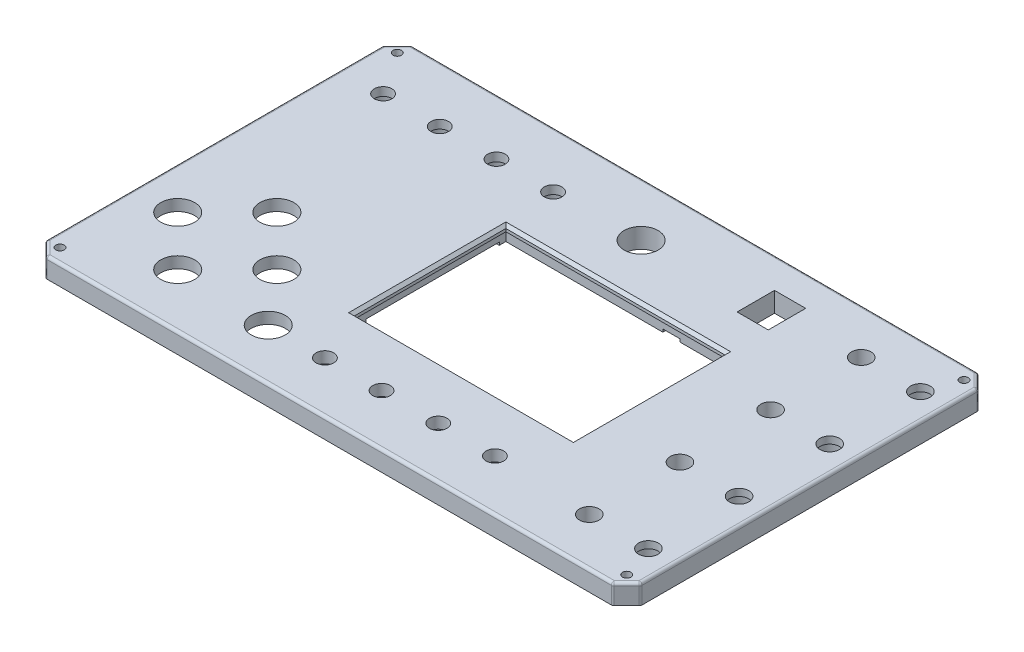
from build123d import *

# Parameters (mm, degrees)
SKETCH1_W           = 105
SKETCH1_H           = 69
BOSS_EXTRUDE1_DEPTH = 5
SKETCH2_W           = 86.836
SKETCH2_H           = 57.499
CUT_EXTRUDE1_DEPTH  = 81.210380614
CUT_EXTRUDE2_DEPTH  = 1
SKETCH4_W           = 5
SKETCH4_H           = 2.165
SKETCH4_H_2         = 0.335
CUT_EXTRUDE3_DEPTH  = 1
CUT_EXTRUDE4_DEPTH  = 81.210380614
SKETCH9_R           = 1
CUT_EXTRUDE7_DEPTH  = 4
SKETCH7_W           = 105
SKETCH7_H           = 30
BOSS_EXTRUDE2_DEPTH = 5
SKETCH8_W           = 11
SKETCH8_H           = 13.2
CUT_EXTRUDE6_DEPTH  = 84.315664794
SKETCH10_W          = 105
SKETCH10_H          = 129
SKETCH10_W_2        = 86.836
SKETCH10_H_2        = 57.499
SKETCH10_W_3        = 11
SKETCH10_H_3        = 13.2
BOSS_EXTRUDE3_DEPTH = 2
SKETCH11_W          = 77.336
SKETCH11_H          = 53.499
BOSS_EXTRUDE4_DEPTH = 2
CHAMFER1_SIZE       = 1
SKETCH12_W          = 65
SKETCH12_H          = 129
SKETCH12_R          = 6
BOSS_EXTRUDE5_DEPTH = 7
CUT_EXTRUDE8_DEPTH  = 135.221831309
CUT_EXTRUDE9_START  = -3
SKETCH16_R          = 5.5
SKETCH16_R_2        = 3.1
CUT_EXTRUDE9_DEPTH  = 3
SKETCH18_R          = 10
CUT_EXTRUDE10_DEPTH = 3
CHAMFER2_SIZE       = 1
SKETCH19_W          = 17.7
SKETCH19_H          = 13.5
CUT_EXTRUDE11_DEPTH = 2
SKETCH20_W          = 17.7
SKETCH20_H          = 3.413443427
SKETCH20_H_2        = 4.222497079
CUT_EXTRUDE12_DEPTH = 1
SKETCH22_W          = 35.5
SKETCH22_H          = 10
SKETCH22_R          = 1
CUT_EXTRUDE13_DEPTH = 2
SKETCH23_R          = 1
CUT_EXTRUDE14_DEPTH = 4
CUT_EXTRUDE15_DEPTH = 1
SKETCH25_R          = 3.1
CUT_EXTRUDE16_DEPTH = 135.221831309
SKETCH26_R          = 5.15
CUT_EXTRUDE17_DEPTH = 4
SKETCH27_W          = 40
SKETCH27_H          = 129
BOSS_EXTRUDE6_DEPTH = 7
LPATTERN1_COUNT     = 2
LPATTERN1_PITCH     = 40
SKETCH28_R          = 3.45
CUT_EXTRUDE18_DEPTH = 135.221831309
SKETCH29_R          = 3.45
CUT_EXTRUDE19_DEPTH = 135.221831309
SKETCH30_R          = 5
CUT_EXTRUDE20_DEPTH = 4.5
SKETCH31_R          = 5.5
CUT_EXTRUDE21_DEPTH = 2
CUT_EXTRUDE22_DEPTH = 2.5
LPATTERN2_COUNT     = 4
LPATTERN2_PITCH     = 32
SKETCH33_R          = 6
CUT_EXTRUDE23_DEPTH = 135.221831309
SKETCH34_R          = 10
CUT_EXTRUDE24_DEPTH = 3
CHAMFER3_SIZE       = 1
CHAMFER4_SIZE       = 5
FILLET1_R           = 1
SKETCH36_R          = 1.5
CUT_EXTRUDE25_DEPTH = 135.221831309
SKETCH38_W          = 2.122677514
SKETCH38_H          = 1.133368936
SKETCH38_W_2        = 1.23177605
SKETCH38_H_2        = 4.109309896
SKETCH38_W_3        = 2.093358764
SKETCH38_H_3        = 1.448947712
SKETCH38_W_4        = 2.046448763
SKETCH38_H_4        = 0.961655006
SKETCH38_H_5        = 1.340362295
CUT_EXTRUDE27_DEPTH = 2
SKETCH40_R          = 6
CUT_EXTRUDE28_DEPTH = 135.221831309


with BuildPart() as part:
    # Sketch1 → Boss-Extrude1 (new body)
    with BuildSketch(Plane(origin=(0, 0, 0), x_dir=(1, 0, 0), z_dir=(0, 1, 0))):
        Rectangle(SKETCH1_W, SKETCH1_H)
    extrude(amount=BOSS_EXTRUDE1_DEPTH)

    # Sketch2 → Cut-Extrude1 (cut, through all)
    with BuildSketch(Plane(origin=(17.072113262, 0, 5.103361153), x_dir=(-1, 0, 0), z_dir=(0, -1, 0))):
        with Locations((16.310113262, 4.341361153)):
            Rectangle(SKETCH2_W, SKETCH2_H)
    extrude(amount=-CUT_EXTRUDE1_DEPTH, mode=Mode.SUBTRACT)

    # Sketch3 → Cut-Extrude2 (cut)
    with BuildSketch(Plane(origin=(17.072113262, 0, 5.103361153), x_dir=(-1, 0, 0), z_dir=(0, -1, 0))):
        Polygon((59.822113262, 30.765861153), (54.524773562, 30.765861153), (54.524773562, -16.234138847), (59.822113262, -16.234138847), (65.822113262, -16.234138847), (65.822113262, 30.765861153), align=None)
    extrude(amount=-CUT_EXTRUDE2_DEPTH, mode=Mode.SUBTRACT)

    # Sketch4 → Cut-Extrude3 (cut)
    with BuildSketch(Plane(origin=(17.072113262, 0, 5.103361153), x_dir=(-1, 0, 0), z_dir=(0, -1, 0))):
        Polygon((-1.187888405, 35.255861153), (3.812111595, 35.255861153), (3.812111595, 33.090861153), (4.312111595, 33.090861153), (4.312111595, 35.755861153), (-1.687888405, 35.755861153), (-1.687888405, 33.090861153), (-1.187888405, 33.090861153), align=None)
        with Locations((1.312111595, 34.173361153)):
            Rectangle(SKETCH4_W, SKETCH4_H)
        Polygon((4.312111595, 33.090861153), (3.812111595, 33.090861153), (3.812111595, 32.755861153), (-1.187888405, 32.755861153), (-1.187888405, 33.090861153), (-1.687888405, 33.090861153), (-1.687888405, 32.255861153), (4.312111595, 32.255861153), align=None)
        with Locations((1.312111595, 32.923361153)):
            Rectangle(SKETCH4_W, SKETCH4_H_2)
    extrude(amount=-CUT_EXTRUDE3_DEPTH, mode=Mode.SUBTRACT)

    # Sketch5 → Cut-Extrude4 (cut, through all)
    with BuildSketch(Plane(origin=(17.072113262, 0, 5.103361153), x_dir=(-1, 0, 0), z_dir=(0, -1, 0))):
        with BuildLine():
            Line((-31.677886738, -0.896638847), (-31.677886738, 11.103361153))
            ThreePointArc((-31.677886738, 11.103361153), (-31.220399504, 12.207833039), (-30.115927617, 12.665320274))
            Line((-30.115927617, 12.665320274), (-28.350143546, 12.665320274))
            ThreePointArc((-28.350143546, 12.665320274), (-27.521232808, 13.008666344), (-27.177886738, 13.837577082))
            Line((-27.177886738, 13.837577082), (-18.865935491, 13.837577082))
            Line((-18.865935491, 13.837577082), (-18.865935491, -4.56597095))
            Line((-18.865935491, -4.56597095), (-27.177886738, -4.56597095))
            ThreePointArc((-27.177886738, -4.56597095), (-27.60841615, -3.526581006), (-28.647806094, -3.096051594))
            Line((-28.647806094, -3.096051594), (-29.478473991, -3.096051594))
            ThreePointArc((-29.478473991, -3.096051594), (-31.033693659, -2.451858515), (-31.677886738, -0.896638847))
        make_face()
    extrude(amount=-CUT_EXTRUDE4_DEPTH, mode=Mode.SUBTRACT)

    # Sketch9 → Cut-Extrude7 (cut)
    with BuildSketch(Plane(origin=(17.072113262, 0, 5.103361153), x_dir=(-1, 0, 0), z_dir=(0, -1, 0))):
        with Locations(Location((-28.677886738, 33.103361153, 0), (0, 0, 90))):
            Circle(SKETCH9_R)
        with Locations(Location((62.822113262, 33.103361153, 0), (0, 0, 90))):
            Circle(SKETCH9_R)
        with Locations(Location((-28.677886738, -22.896638847, 0), (0, 0, 90))):
            Circle(SKETCH9_R)
        with Locations(Location((62.822113262, -22.896638847, 0), (0, 0, 90))):
            Circle(SKETCH9_R)
    extrude(amount=-CUT_EXTRUDE7_DEPTH, mode=Mode.SUBTRACT)

    # Sketch7 → Boss-Extrude2 (add)
    with BuildSketch(Plane(origin=(0, 5, 0), x_dir=(1, 0, 0), z_dir=(0, 1, 0))):
        with Locations((0, 49.5)):
            Rectangle(SKETCH7_W, SKETCH7_H)
        with Locations((0, -49.5)):
            Rectangle(SKETCH7_W, SKETCH7_H)
    extrude(amount=-BOSS_EXTRUDE2_DEPTH)

    # Sketch8 → Cut-Extrude6 (cut, through all)
    with BuildSketch(Plane(origin=(0, 5, 0), x_dir=(1, 0, 0), z_dir=(0, 1, 0))):
        with Locations((32.18, 46.886314888)):
            Rectangle(SKETCH8_W, SKETCH8_H)
    extrude(amount=-CUT_EXTRUDE6_DEPTH, mode=Mode.SUBTRACT)

    # Sketch10 → Boss-Extrude3 (add)
    with BuildSketch(Plane(origin=(0, 5, 0), x_dir=(1, 0, 0), z_dir=(0, 1, 0))):
        Rectangle(SKETCH10_W, SKETCH10_H)
        with Locations((0.762, -0.762)):
            Rectangle(SKETCH10_W_2, SKETCH10_H_2, mode=Mode.SUBTRACT)
        with Locations((32.18, 46.886314888)):
            Rectangle(SKETCH10_W_3, SKETCH10_H_3, mode=Mode.SUBTRACT)
    extrude(amount=BOSS_EXTRUDE3_DEPTH)

    # Sketch11 → Boss-Extrude4 (add)
    with BuildSketch(Plane(origin=(0, 7, 0), x_dir=(1, 0, 0), z_dir=(0, 1, 0))):
        Polygon((-40.656, 27.9875), (-42.656, 27.9875), (-42.656, 25.9875), (-42.656, -27.5115), (-42.656, -29.5115), (-40.656, -29.5115), (36.68, -29.5115), (44.18, -29.5115), (44.18, 27.9875), (36.68, 27.9875), align=None)
        with Locations((-1.988, -0.762)):
            Rectangle(SKETCH11_W, SKETCH11_H, mode=Mode.SUBTRACT)
    extrude(amount=-BOSS_EXTRUDE4_DEPTH)

    # Chamfer1
    chamfer1_edges = [part.edges().sort_by_distance(p)[0] for p in [
        (-40.656, 7, 0.762),
        (-1.988, 7, 27.5115),
        (36.68, 7, 0.762),
        (-1.988, 7, -25.9875),
    ]]
    chamfer(chamfer1_edges, length=CHAMFER1_SIZE)

    # Sketch12 → Boss-Extrude5 (add)
    with BuildSketch(Plane(origin=(0, 7, 0), x_dir=(1, 0, 0), z_dir=(0, 1, 0))):
        with Locations((-85, 0)):
            Rectangle(SKETCH12_W, SKETCH12_H)
        with Locations(Location((-85, -45.5, 0), (0, 0, 270))):
            Circle(SKETCH12_R, mode=Mode.SUBTRACT)
        with Locations(Location((-102.5, -28, 0), (0, 0, 270))):
            Circle(SKETCH12_R, mode=Mode.SUBTRACT)
        with Locations(Location((-67.5, -28, 0), (0, 0, 270))):
            Circle(SKETCH12_R, mode=Mode.SUBTRACT)
        with Locations(Location((-85, -10.5, 0), (0, 0, 270))):
            Circle(SKETCH12_R, mode=Mode.SUBTRACT)
    extrude(amount=-BOSS_EXTRUDE5_DEPTH)

    # Sketch15 → Cut-Extrude8 (cut, through all)
    with BuildSketch(Plane(origin=(0, 7, 0), x_dir=(1, 0, 0), z_dir=(0, 1, 0))):
        with BuildLine():
            ThreePointArc((-28.941, -46.50575), (-32.041, -43.40575), (-35.141, -46.50575))
            Line((-35.141, -46.50575), (-28.941, -46.50575))
        make_face()
        with BuildLine():
            Line((-28.941, -46.50575), (-35.141, -46.50575))
            ThreePointArc((-35.141, -46.50575), (-32.041, -49.60575), (-28.941, -46.50575))
        make_face()
        with BuildLine():
            ThreePointArc((-8.941, -46.50575), (-12.041, -43.40575), (-15.141, -46.50575))
            Line((-15.141, -46.50575), (-8.941, -46.50575))
        make_face()
        with BuildLine():
            Line((-8.941, -46.50575), (-15.141, -46.50575))
            ThreePointArc((-15.141, -46.50575), (-12.041, -49.60575), (-8.941, -46.50575))
        make_face()
        with BuildLine():
            ThreePointArc((4.859, -46.50575), (7.959, -49.60575), (11.059, -46.50575))
            Line((11.059, -46.50575), (4.859, -46.50575))
        make_face()
        with BuildLine():
            Line((4.859, -46.50575), (11.059, -46.50575))
            ThreePointArc((11.059, -46.50575), (7.959, -43.40575), (4.859, -46.50575))
        make_face()
        with BuildLine():
            ThreePointArc((24.859, -46.50575), (27.959, -49.60575), (31.059, -46.50575))
            Line((31.059, -46.50575), (24.859, -46.50575))
        make_face()
        with BuildLine():
            Line((24.859, -46.50575), (31.059, -46.50575))
            ThreePointArc((31.059, -46.50575), (27.959, -43.40575), (24.859, -46.50575))
        make_face()
    extrude(amount=-CUT_EXTRUDE8_DEPTH, mode=Mode.SUBTRACT)

    # Sketch16 → Cut-Extrude9 (cut)
    # profile 1 of 4: a face of its own
    with BuildSketch(Plane.XZ.offset(CUT_EXTRUDE9_START)):
        with Locations(Location((-32.041, 46.50575, 0), (0, 0, 270))):
            Circle(SKETCH16_R)
        with Locations(Location((-32.041, 46.50575, 0), (0, 0, 90))):
            Circle(SKETCH16_R_2, mode=Mode.SUBTRACT)
    # profile 2 of 4: a face of its own
    with BuildSketch(Plane.XZ.offset(CUT_EXTRUDE9_START)):
        with Locations(Location((-12.041, 46.50575, 0), (0, 0, 270))):
            Circle(SKETCH16_R)
        with Locations(Location((-12.041, 46.50575, 0), (0, 0, 90))):
            Circle(SKETCH16_R_2, mode=Mode.SUBTRACT)
    # profile 3 of 4: a face of its own
    with BuildSketch(Plane.XZ.offset(CUT_EXTRUDE9_START)):
        with Locations(Location((7.959, 46.50575, 0), (0, 0, 270))):
            Circle(SKETCH16_R)
        with Locations(Location((7.959, 46.50575, 0), (0, 0, 90))):
            Circle(SKETCH16_R_2, mode=Mode.SUBTRACT)
    # profile 4 of 4: a face of its own
    with BuildSketch(Plane.XZ.offset(CUT_EXTRUDE9_START)):
        with Locations(Location((27.959, 46.50575, 0), (0, 0, 270))):
            Circle(SKETCH16_R)
        with Locations(Location((27.959, 46.50575, 0), (0, 0, 90))):
            Circle(SKETCH16_R_2, mode=Mode.SUBTRACT)
    extrude(amount=CUT_EXTRUDE9_DEPTH, mode=Mode.SUBTRACT)

    # Sketch18 → Cut-Extrude10 (cut)
    with BuildSketch(Plane.XZ):
        with Locations(Location((-85, 45.5, 0), (0, 0, 270))):
            Circle(SKETCH18_R)
        with Locations(Location((-102.5, 28, 0), (0, 0, 270))):
            Circle(SKETCH18_R)
        with Locations(Location((-85, 10.5, 0), (0, 0, 270))):
            Circle(SKETCH18_R)
        with Locations(Location((-67.5, 28, 0), (0, 0, 270))):
            Circle(SKETCH18_R)
    extrude(amount=-CUT_EXTRUDE10_DEPTH, mode=Mode.SUBTRACT)

    # Chamfer2
    chamfer2_edges = [part.edges().sort_by_distance(p)[0] for p in [
        (-85, 0, 20.5),
        (-102.5, 0, 38),
        (-67.5, 0, 38),
        (-85, 0, 55.5),
    ]]
    chamfer(chamfer2_edges, length=CHAMFER2_SIZE)

    # Sketch19 → Cut-Extrude11 (cut)
    with BuildSketch(Plane.XZ):
        with Locations((9.346, -57.75)):
            Rectangle(SKETCH19_W, SKETCH19_H)
    extrude(amount=-CUT_EXTRUDE11_DEPTH, mode=Mode.SUBTRACT)

    # Sketch20 → Cut-Extrude12 (cut)
    with BuildSketch(Plane.XZ.offset(-2)):
        with Locations((9.346, -62.793278286)):
            Rectangle(SKETCH20_W, SKETCH20_H)
        with Locations((9.346, -53.111248539)):
            Rectangle(SKETCH20_W, SKETCH20_H_2)
    extrude(amount=-CUT_EXTRUDE12_DEPTH, mode=Mode.SUBTRACT)

    # Sketch22 → Cut-Extrude13 (cut)
    with BuildSketch(Plane.XZ):
        with Locations((-42.589089221, -59.5)):
            Rectangle(SKETCH22_W, SKETCH22_H)
        with Locations(Location((-57.839089221, -59.5, 0), (0, 0, 270))):
            Circle(SKETCH22_R, mode=Mode.SUBTRACT)
    extrude(amount=-CUT_EXTRUDE13_DEPTH, mode=Mode.SUBTRACT)

    # Sketch23 → Cut-Extrude14 (cut)
    with BuildSketch(Plane.XZ):
        with Locations(Location((-57.839089221, -59.5, 0), (0, 0, 270))):
            Circle(SKETCH23_R)
    extrude(amount=-CUT_EXTRUDE14_DEPTH, mode=Mode.SUBTRACT)

    # Sketch24 → Cut-Extrude15 (cut)
    with BuildSketch(Plane.XZ.offset(-2)):
        with BuildLine():
            Line((-35.839089221, -62.003634145), (-25.839089221, -62.003634145))
            ThreePointArc((-25.839089221, -62.003634145), (-24.842723365, -63), (-25.839089221, -63.996365855))
            Line((-25.839089221, -63.996365855), (-35.839089221, -63.996365855))
            ThreePointArc((-35.839089221, -63.996365855), (-36.835455076, -63), (-35.839089221, -62.003634145))
        make_face()
    extrude(amount=-CUT_EXTRUDE15_DEPTH, mode=Mode.SUBTRACT)

    # Sketch25 → Cut-Extrude16 (cut, through all)
    with BuildSketch(Plane(origin=(0, 7, 0), x_dir=(1, 0, 0), z_dir=(0, 1, 0))):
        with Locations(Location((-102.5, 44.5, 0), (0, 0, 270))):
            Circle(SKETCH25_R)
        with Locations(Location((-82.5, 44.5, 0), (0, 0, 270))):
            Circle(SKETCH25_R)
    cut_extrude16 = extrude(amount=-CUT_EXTRUDE16_DEPTH, mode=Mode.SUBTRACT)

    # Sketch26 → Cut-Extrude17 (cut)
    with BuildSketch(Plane.XZ):
        with Locations(Location((-102.5, -44.5, 0), (0, 0, 270))):
            Circle(SKETCH26_R)
        with Locations(Location((-82.5, -44.5, 0), (0, 0, 270))):
            Circle(SKETCH26_R)
    cut_extrude17 = extrude(amount=-CUT_EXTRUDE17_DEPTH, mode=Mode.SUBTRACT)

    # Sketch27 → Boss-Extrude6 (add)
    with BuildSketch(Plane(origin=(0, 7, 0), x_dir=(1, 0, 0), z_dir=(0, 1, 0))):
        with Locations((72.5, 0)):
            Rectangle(SKETCH27_W, SKETCH27_H)
    extrude(amount=-BOSS_EXTRUDE6_DEPTH)

    # LPattern1: Cut-Extrude16, Cut-Extrude17 ×2
    with Locations(*[(i * LPATTERN1_PITCH, 0, 0) for i in range(1, LPATTERN1_COUNT)]):
        add(cut_extrude16, mode=Mode.SUBTRACT)
        add(cut_extrude17, mode=Mode.SUBTRACT)

    # Sketch28 → Cut-Extrude18 (cut, through all)
    with BuildSketch(Plane(origin=(0, 7, 0), x_dir=(1, 0, 0), z_dir=(0, 1, 0))):
        with Locations(Location((62.5, 48.27975, 0), (0, 0, 270))):
            Circle(SKETCH28_R)
        with Locations(Location((62.5, 16.27975, 0), (0, 0, 270))):
            Circle(SKETCH28_R)
        with Locations(Location((62.5, -15.72025, 0), (0, 0, 270))):
            Circle(SKETCH28_R)
        with Locations(Location((62.5, -47.72025, 0), (0, 0, 270))):
            Circle(SKETCH28_R)
    extrude(amount=-CUT_EXTRUDE18_DEPTH, mode=Mode.SUBTRACT)

    # Sketch29 → Cut-Extrude19 (cut, through all)
    with BuildSketch(Plane(origin=(0, 7, 0), x_dir=(1, 0, 0), z_dir=(0, 1, 0))):
        with Locations(Location((83.375, 48.27975, 0), (0, 0, 270))):
            Circle(SKETCH29_R)
        with Locations(Location((83.375, 16.27975, 0), (0, 0, 270))):
            Circle(SKETCH29_R)
        with Locations(Location((83.375, -15.72025, 0), (0, 0, 270))):
            Circle(SKETCH29_R)
        with Locations(Location((83.375, -47.72025, 0), (0, 0, 270))):
            Circle(SKETCH29_R)
    extrude(amount=-CUT_EXTRUDE19_DEPTH, mode=Mode.SUBTRACT)

    # Sketch30 → Cut-Extrude20 (cut)
    with BuildSketch(Plane.XZ):
        with Locations(Location((83.375, -48.27975, 0), (0, 0, 270))):
            Circle(SKETCH30_R)
        with Locations(Location((83.375, -16.27975, 0), (0, 0, 270))):
            Circle(SKETCH30_R)
        with Locations(Location((83.375, 15.72025, 0), (0, 0, 270))):
            Circle(SKETCH30_R)
        with Locations(Location((83.375, 47.72025, 0), (0, 0, 270))):
            Circle(SKETCH30_R)
    extrude(amount=-CUT_EXTRUDE20_DEPTH, mode=Mode.SUBTRACT)

    # Sketch31 → Cut-Extrude21 (cut)
    with BuildSketch(Plane.XZ):
        with Locations(Location((62.5, 47.72025, 0), (0, 0, 270))):
            Circle(SKETCH31_R)
        with Locations(Location((62.5, 15.72025, 0), (0, 0, 270))):
            Circle(SKETCH31_R)
        with Locations(Location((62.5, -16.27975, 0), (0, 0, 270))):
            Circle(SKETCH31_R)
        with Locations(Location((62.5, -48.27975, 0), (0, 0, 270))):
            Circle(SKETCH31_R)
    extrude(amount=-CUT_EXTRUDE21_DEPTH, mode=Mode.SUBTRACT)

    # Sketch32 → Cut-Extrude22 (cut)
    with BuildSketch(Plane.XZ):
        with BuildLine():
            Line((69.950503339, 49.22025), (70.968175719, 49.22025))
            ThreePointArc((70.968175719, 49.22025), (71.1, 47.72025), (70.968175719, 46.22025))
            Line((70.968175719, 46.22025), (69.950503339, 46.22025))
            ThreePointArc((69.950503339, 46.22025), (70.1, 47.72025), (69.950503339, 49.22025))
        make_face()
        with BuildLine():
            Line((61, 56.188425719), (61, 55.170753339))
            ThreePointArc((61, 55.170753339), (62.5, 55.32025), (64, 55.170753339))
            Line((64, 55.170753339), (64, 56.188425719))
            ThreePointArc((64, 56.188425719), (62.5, 56.32025), (61, 56.188425719))
        make_face()
        with BuildLine():
            Line((54.031824281, 49.22025), (55.049496661, 49.22025))
            ThreePointArc((55.049496661, 49.22025), (54.9, 47.72025), (55.049496661, 46.22025))
            Line((55.049496661, 46.22025), (54.031824281, 46.22025))
            ThreePointArc((54.031824281, 46.22025), (53.9, 47.72025), (54.031824281, 49.22025))
        make_face()
        with BuildLine():
            Line((64, 40.269746661), (64, 39.252074281))
            ThreePointArc((64, 39.252074281), (62.5, 39.12025), (61, 39.252074281))
            Line((61, 39.252074281), (61, 40.269746661))
            ThreePointArc((61, 40.269746661), (62.5, 40.12025), (64, 40.269746661))
        make_face()
    cut_extrude22 = extrude(amount=-CUT_EXTRUDE22_DEPTH, mode=Mode.SUBTRACT)

    # LPattern2: Cut-Extrude22 ×4
    with Locations(*[(0, 0, -i * LPATTERN2_PITCH) for i in range(1, LPATTERN2_COUNT)]):
        add(cut_extrude22, mode=Mode.SUBTRACT)

    # Sketch33 → Cut-Extrude23 (cut, through all)
    with BuildSketch(Plane(origin=(0, 7, 0), x_dir=(1, 0, 0), z_dir=(0, 1, 0))):
        with Locations(Location((-52.041, -46.50575, 0), (0, 0, 270))):
            Circle(SKETCH33_R)
    extrude(amount=-CUT_EXTRUDE23_DEPTH, mode=Mode.SUBTRACT)

    # Sketch34 → Cut-Extrude24 (cut)
    with BuildSketch(Plane.XZ):
        with Locations(Location((-52.041, 46.50575, 0), (0, 0, 270))):
            Circle(SKETCH34_R)
    extrude(amount=-CUT_EXTRUDE24_DEPTH, mode=Mode.SUBTRACT)

    # Chamfer3
    chamfer3_edges = [part.edges().sort_by_distance(p)[0] for p in [
        (-52.041, 0, 56.50575),
    ]]
    chamfer(chamfer3_edges, length=CHAMFER3_SIZE)

    # Chamfer4
    chamfer4_edges = [part.edges().sort_by_distance(p)[0] for p in [
        (-117.5, 3.5, -64.5),
        (-117.5, 3.5, 64.5),
        (92.5, 3.5, -64.5),
        (92.5, 3.5, 64.5),
    ]]
    chamfer(chamfer4_edges, length=CHAMFER4_SIZE)

    # Fillet1
    fillet1_edges = [part.edges().sort_by_distance(p)[0] for p in [
        (92.5, 7, 0),
        (92.5, 3.5, 59.5),
        (92.5, 3.5, -59.5),
        (-12.5, 7, -64.5),
        (-117.5, 7, 0),
        (-12.5, 7, 64.5),
        (-115, 7, -62),
        (-115, 7, 62),
        (90, 7, 62),
        (90, 7, -62),
        (-112.5, 3.5, -64.5),
        (87.5, 3.5, -64.5),
        (-112.5, 3.5, 64.5),
        (87.5, 3.5, 64.5),
        (-117.5, 3.5, -59.5),
        (-117.5, 3.5, 59.5),
    ]]
    fillet(fillet1_edges, radius=FILLET1_R)

    # Sketch36 → Cut-Extrude25 (cut, through all)
    with BuildSketch(Plane.XZ):
        with Locations(Location((87.525126266, 59.525126266, 0), (0, 0, 270))):
            Circle(SKETCH36_R)
        with Locations(Location((87.525126266, -59.525126266, 0), (0, 0, 270))):
            Circle(SKETCH36_R)
        with Locations(Location((-112.525126266, -59.525126266, 0), (0, 0, 270))):
            Circle(SKETCH36_R)
        with Locations(Location((-112.526828082, 59.526828082, 0), (0, 0, 270))):
            Circle(SKETCH36_R)
    extrude(amount=-CUT_EXTRUDE25_DEPTH, mode=Mode.SUBTRACT)

    # Sketch38 → Cut-Extrude27 (cut)
    # profile 1 of 26: a face of its own
    with BuildSketch(Plane.XZ):
        Polygon((-112.385598158, -24.375998175), (-109.048802949, -26.612612047), (-109.048802949, -24.375998175), (-107.83176332, -24.375998175), (-107.83176332, -28.485308071), (-111.185901245, -26.266259768), (-111.185901245, -28.485308071), (-112.385598158, -28.485308071), align=None)
    # profile 2 of 26: a face of its own
    with BuildSketch(Plane.XZ):
        Polygon((-107.333036384, -28.442846833), (-107.333036384, -24.348284128), (-106.101648876, -24.348284128), (-106.101648876, -26.095681639), (-103.932061362, -26.095681639), (-103.932061362, -24.348284128), (-102.677218854, -24.348284128), (-102.677218854, -28.442846833), align=None)
        with Locations((-105.010991369, -27.272196111)):
            Rectangle(SKETCH38_W, SKETCH38_H, mode=Mode.SUBTRACT)
    # profile 3 of 26: a face of its own
    with BuildSketch(Plane.XZ):
        Polygon((-101.92893128, -27.880613612), (-100.413223971, -27.880613612), (-100.413223971, -24.375998175), (-99.19012425, -24.375998175), (-99.19012425, -27.880613612), (-97.656860485, -27.880613612), (-97.136018977, -28.485308071), (-102.449956704, -28.485308071), align=None)
    # profile 4 of 26: a face of its own
    with BuildSketch(Plane.XZ):
        with Locations((-96.128202472, -26.430653123)):
            Rectangle(SKETCH38_W_2, SKETCH38_H_2)
    # profile 5 of 26: a face of its own
    with BuildSketch(Plane.XZ):
        Polygon((-94.653652839, -27.880613612), (-93.137945529, -27.880613612), (-93.137945529, -24.375998175), (-91.914845808, -24.375998175), (-91.914845808, -27.880613612), (-90.381582043, -27.880613612), (-89.860740535, -28.485308071), (-95.174678262, -28.485308071), align=None)
    # profile 6 of 26: a face of its own
    with BuildSketch(Plane.XZ):
        Polygon((-87.595546888, -27.880613612), (-86.079839578, -27.880613612), (-86.079839578, -24.375998175), (-84.856739857, -24.375998175), (-84.856739857, -27.880613612), (-83.323476092, -27.880613612), (-82.802634584, -28.485308071), (-88.116572311, -28.485308071), align=None)
    # profile 7 of 26: a face of its own
    with BuildSketch(Plane.XZ):
        Polygon((-82.632967747, -24.98064707), (-82.106749616, -24.375998175), (-78.024838958, -24.375998175), (-78.024838958, -28.485308071), (-82.627222465, -28.485308071), (-82.106749616, -27.880613612), (-79.276312999, -27.880613612), (-79.276312999, -24.98064707), align=None)
    # profile 8 of 26: a face of its own
    with BuildSketch(Plane.XZ):
        Polygon((-77.153032376, -24.968131716), (-77.680695319, -24.364165463), (-73.084164792, -24.364165463), (-73.084164792, -28.442846833), (-77.692293581, -28.442846833), (-77.170621141, -27.838880579), (-74.315378326, -27.838880579), (-74.315378326, -26.705511643), (-77.416863848, -26.705511643), (-77.416863848, -26.101501481), (-74.315378326, -26.101501481), (-74.315378326, -24.968131716), align=None)
    # profile 9 of 26: a face of its own
    with BuildSketch(Plane.XZ):
        Polygon((-69.70227554, -24.375998175), (-69.175059958, -24.98064707), (-71.430371057, -24.98064707), (-71.430371057, -28.485308071), (-72.64303317, -28.485308071), (-72.64303317, -24.375998175), align=None)
    # profile 10 of 26: a face of its own
    with BuildSketch(Plane.XZ):
        Polygon((-68.837424601, -24.370908195), (-68.837424601, -28.490398052), (-64.18518265, -28.490398052), (-64.18518265, -25.496688554), (-65.187090254, -24.370908195), align=None)
        Polygon((-67.605648552, -27.899959514), (-67.605648552, -24.961345905), (-66.109618522, -24.961345905), (-65.4169587, -25.764359879), (-65.4169587, -27.899959514), align=None, mode=Mode.SUBTRACT)
    # profile 11 of 26: a face of its own
    with BuildSketch(Plane.XZ):
        Polygon((-63.923182047, -24.346977666), (-62.474835788, -24.346977666), (-60.264202024, -26.868390182), (-62.339969537, -26.868390182), (-62.339969537, -27.838880579), (-60.108108467, -27.838880579), (-60.108108467, -24.346977666), (-58.864993459, -24.346977666), (-58.864993459, -28.442846833), (-63.547902045, -28.442846833), (-63.547902045, -26.264423929), (-62.246149536, -26.264423929), align=None)
    # profile 12 of 26: a face of its own
    with BuildSketch(Plane.XZ):
        Polygon((-55.100501558, -25.835169756), (-55.100501558, -24.380959746), (-53.869114051, -24.380959746), (-53.869114051, -28.492049975), (-58.41352033, -28.492049975), (-58.41352033, -25.835169756), align=None)
        with Locations((-56.13545344, -27.163609866)):
            Rectangle(SKETCH38_W_3, SKETCH38_H_3, mode=Mode.SUBTRACT)
    # profile 13 of 26: a face of its own
    with BuildSketch(Plane.XZ):
        Polygon((-109.067913571, -16.288871715), (-107.619567312, -16.288871715), (-105.408933548, -18.810284232), (-107.484701061, -18.810284232), (-107.484701061, -19.780774628), (-105.252839992, -19.780774628), (-105.252839992, -16.288871715), (-104.009724984, -16.288871715), (-104.009724984, -20.384740882), (-108.692633569, -20.384740882), (-108.692633569, -18.206317978), (-107.39088106, -18.206317978), align=None)
    # profile 14 of 26: a face of its own
    with BuildSketch(Plane.XZ):
        Polygon((-103.132291588, -16.910025766), (-103.659954531, -16.306059512), (-99.063424004, -16.306059512), (-99.063424004, -20.384740882), (-103.671552793, -20.384740882), (-103.149880352, -19.780774628), (-100.294637538, -19.780774628), (-100.294637538, -18.647405692), (-103.396123059, -18.647405692), (-103.396123059, -18.04339553), (-100.294637538, -18.04339553), (-100.294637538, -16.910025766), align=None)
    # profile 15 of 26: a face of its own
    with BuildSketch(Plane.XZ):
        Polygon((-98.318438621, -19.822507661), (-96.802731311, -19.822507661), (-96.802731311, -16.317892225), (-95.57963159, -16.317892225), (-95.57963159, -19.822507661), (-94.046367825, -19.822507661), (-93.525526317, -20.42720212), (-98.839464044, -20.42720212), align=None)
    # profile 16 of 26: a face of its own
    with BuildSketch(Plane.XZ):
        Polygon((-92.997712596, -19.822507661), (-91.482005287, -19.822507661), (-91.482005287, -16.317892225), (-90.258905566, -16.317892225), (-90.258905566, -19.822507661), (-88.725641801, -19.822507661), (-88.204800293, -20.42720212), (-93.51873802, -20.42720212), align=None)
    # profile 17 of 26: a face of its own
    with BuildSketch(Plane.XZ):
        Polygon((-87.550165373, -16.910025766), (-88.077828316, -16.306059512), (-83.481297789, -16.306059512), (-83.481297789, -20.384740882), (-88.089426578, -20.384740882), (-87.567754138, -19.780774628), (-84.712511323, -19.780774628), (-84.712511323, -18.647405692), (-87.813996844, -18.647405692), (-87.813996844, -18.04339553), (-84.712511323, -18.04339553), (-84.712511323, -16.910025766), align=None)
    # profile 18 of 26: a face of its own
    with BuildSketch(Plane.XZ):
        Polygon((-83.039143035, -16.311149492), (-78.541646756, -16.311149492), (-78.541646756, -20.434616724), (-82.681454283, -20.434616724), (-82.681454283, -18.868995464), (-83.039143035, -18.868995464), align=None)
        with Locations((-80.790394896, -19.349822967)):
            Rectangle(SKETCH38_W_4, SKETCH38_H_4, mode=Mode.SUBTRACT)
        with Locations((-80.790394896, -17.585296894)):
            Rectangle(SKETCH38_W_4, SKETCH38_H_5, mode=Mode.SUBTRACT)
    # profile 19 of 26: a face of its own
    with BuildSketch(Plane.XZ):
        Polygon((-76.058258314, -19.822507661), (-74.542551005, -19.822507661), (-74.542551005, -16.317892225), (-73.319451284, -16.317892225), (-73.319451284, -19.822507661), (-71.786187518, -19.822507661), (-71.26534601, -20.42720212), (-76.579283738, -20.42720212), align=None)
    # profile 20 of 26: a face of its own
    with BuildSketch(Plane.XZ):
        Polygon((-70.955250727, -16.927373452), (-70.424137301, -16.306059512), (-66.741361786, -16.306059512), (-66.216084771, -16.910025766), (-69.50198432, -16.910025766), (-69.717931537, -17.15867594), (-69.717931537, -18.04339553), (-66.373667875, -18.04339553), (-66.373667875, -19.734321931), (-66.928126947, -20.384740882), (-71.095678345, -20.384740882), (-70.581720406, -19.780774628), (-67.85611634, -19.780774628), (-67.593477832, -19.48438932), (-67.593477832, -18.647405692), (-70.955250727, -18.647405692), align=None)
    # profile 21 of 26: a face of its own
    with BuildSketch(Plane.XZ):
        Polygon((-65.774953149, -20.42720212), (-65.774953149, -16.317892225), (-61.16682436, -16.317892225), (-61.16682436, -20.42720212), (-62.386312051, -20.42720212), (-62.386312051, -16.922541119), (-64.573181804, -16.922541119), (-64.573181804, -20.42720212), align=None)
    # profile 22 of 26: a face of its own
    with BuildSketch(Plane.XZ):
        Polygon((-57.784935107, -16.317892225), (-57.257719526, -16.922541119), (-59.513030625, -16.922541119), (-59.513030625, -20.42720212), (-60.725692738, -20.42720212), (-60.725692738, -16.317892225), align=None)
    # profile 23 of 26: a face of its own
    with BuildSketch(Plane.XZ):
        Polygon((-91.614750712, -8.254696293), (-92.83441072, -9.614446741), (-91.614750712, -10.96256496), (-89.392389448, -10.96256496), (-89.392389448, -11.783747612), (-92.312536967, -11.783747612), (-92.83441072, -12.37418615), (-88.313459441, -12.37418615), (-88.313459441, -10.37212725), (-90.694141957, -10.37212725), (-91.374336961, -9.614446741), (-90.694141957, -8.845134003), (-88.647693193, -8.845134003), (-88.12581944, -8.254696293), align=None)
    # profile 24 of 26: a face of its own
    with BuildSketch(Plane.XZ):
        Polygon((-87.344538124, -8.247953561), (-83.459068891, -8.247953561), (-83.459068891, -10.589299741), (-86.488914432, -10.589299741), (-86.488914432, -11.426283369), (-86.2251948, -11.722668677), (-83.834136811, -11.722668677), (-83.318418421, -12.326634931), (-87.157004164, -12.326634931), (-87.713745607, -11.67621598), (-87.713745607, -9.98528958), (-84.701481376, -9.98528958), (-84.701481376, -8.851919815), (-87.872253259, -8.851919815), align=None)
    # profile 25 of 26: a face of its own
    with BuildSketch(Plane.XZ):
        Polygon((-82.931579093, -11.724308175), (-82.386976888, -12.37418615), (-78.873817674, -12.37418615), (-78.323451133, -11.724308175), (-78.323451133, -8.90437627), (-78.873817674, -8.254696293), (-82.386976888, -8.254696293), (-82.931579093, -8.90437627), align=None)
        Polygon((-81.743917034, -11.439945293), (-81.743917034, -9.200587604), (-81.447003177, -8.845134003), (-79.813967845, -8.845134003), (-79.51111402, -9.200587604), (-79.51111402, -11.439945293), (-79.813967845, -11.783747612), (-81.447003177, -11.783747612), align=None, mode=Mode.SUBTRACT)
    # profile 26 of 26: a face of its own
    with BuildSketch(Plane.XZ):
        Polygon((-77.463189793, -8.247953561), (-73.57772056, -8.247953561), (-73.57772056, -10.589299741), (-76.6075661, -10.589299741), (-76.6075661, -11.426283369), (-76.343846469, -11.722668677), (-73.95278848, -11.722668677), (-73.43707009, -12.326634931), (-77.275655833, -12.326634931), (-77.832397276, -11.67621598), (-77.832397276, -9.98528958), (-74.820133045, -9.98528958), (-74.820133045, -8.851919815), (-77.990904928, -8.851919815), align=None)
    extrude(amount=-CUT_EXTRUDE27_DEPTH, mode=Mode.SUBTRACT)

    # Sketch40 → Cut-Extrude28 (cut, through all)
    with BuildSketch(Plane(origin=(0, 7, 0), x_dir=(1, 0, 0), z_dir=(0, 1, 0))):
        with Locations(Location((-12.17154461, 45.24375, 0), (0, 0, 270))):
            Circle(SKETCH40_R)
    extrude(amount=-CUT_EXTRUDE28_DEPTH, mode=Mode.SUBTRACT)


solid = part.part
